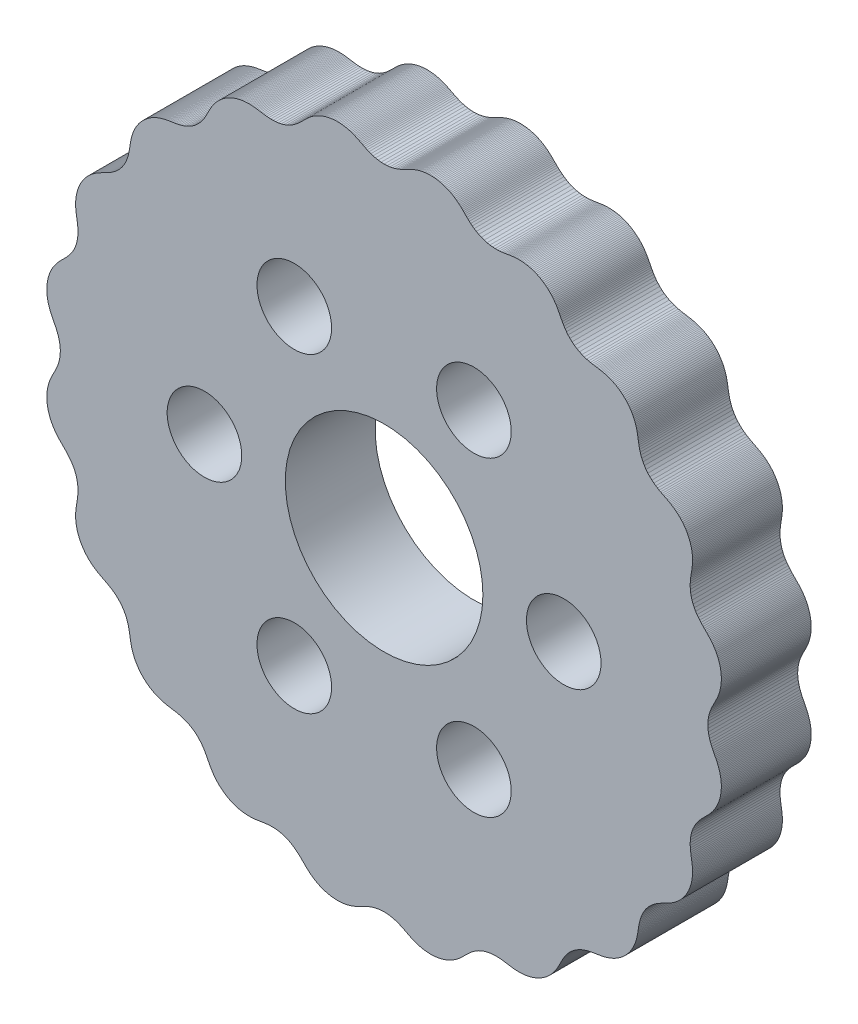
from build123d import *

# Parameters (mm, degrees)
MODEL_R             = 11
MODEL_R_2           = 4.15238095
BOSS_EXTRUDE1_DEPTH = 10


with BuildPart() as part:
    # Model → Boss-Extrude1 (new body)
    with BuildSketch(Plane.XY):
        Polygon((36.04761905, 0), (36.06137418, -0.33384437), (36.10068915, -0.65548231), (36.1604355, -0.9553158), (36.23400799, -1.22779715), (36.31504682, -1.47138623), (36.39850594, -1.68753694), (36.48096998, -1.87943994), (36.56047524, -2.05098989), (36.63613272, -2.2061181), (36.70774644, -2.34844079), (36.77550914, -2.4811182), (36.83978991, -2.60683211), (36.90099955, -2.72781973), (36.95951242, -2.84592824), (37.01562612, -2.96267195), (37.06954492, -3.07928401), (37.12137746, -3.1967604), (37.17114246, -3.31589586), (37.21877876, -3.43731283), (37.26415718, -3.56148478), (37.30709308, -3.68875492), (37.34735867, -3.81935152), (37.38469479, -3.95340063), (37.4188218, -4.09093693), (37.44944971, -4.23191308), (37.47628728, -4.37620823), (37.49905028, -4.52363572), (37.51746882, -4.6739504), (37.53129382, -4.82685556), (37.54030267, -4.98200972), (37.54430398, -5.13903327), (37.54314162, -5.29751505), (37.53669791, -5.45701883), (37.52489604, -5.61708986), (37.50770174, -5.77726126), (37.48512416, -5.93706041), (37.45721606, -6.09601529), (37.42407313, -6.25366067), (37.38583271, -6.40954425), (37.34267166, -6.56323258), (37.29480357, -6.71431689), (37.24247515, -6.86241869), (37.18596195, -7.00719518), (37.1255633, -7.14834446), (37.06159644, -7.28561058), (36.99438994, -7.41878831), (36.92427624, -7.54772788), (36.85158334, -7.67233962), (36.77662557, -7.79259858), (36.69969336, -7.90854938), (36.62104193, -8.02031137), (36.54087883, -8.12808454), (36.45935015, -8.23215638), (36.37652543, -8.33291036), (36.29238122, -8.43083668), (36.20678334, -8.52654623), (36.1194684, -8.62078907), (36.03002532, -8.71447884), (35.93787873, -8.80872525), (35.84227768, -8.90487649), (35.7422953, -9.00457367), (35.63684957, -9.10981756), (35.52476074, -9.22304462), (35.40486894, -9.34720087), (35.2762431, -9.48578609), (35.13851385, -9.6428139), (34.99234527, -9.82259516), (34.8399996, -10.02921976), (34.68582663, -10.26562977), (34.53635084, -10.53232573), (34.39956849, -10.82607259), (34.28332299, -11.13932689), (34.19324132, -11.46108233), (34.13124049, -11.77912718), (34.09540899, -12.08274841), (34.08117922, -12.36462872), (34.08297857, -12.62133808), (34.09555866, -12.85269991), (34.11468534, -13.0606933), (34.13728748, -13.24841547), (34.16130477, -13.41933061), (34.18543334, -13.57681739), (34.20887992, -13.72394093), (34.23116683, -13.86336581), (34.25199343, -13.9973467), (34.27114493, -14.12775604), (34.28843644, -14.25612599), (34.30368116, -14.38369248), (34.31667463, -14.5114363), (34.32718909, -14.64011909), (34.33497399, -14.77031392), (34.33976018, -14.90243116), (34.34126601, -15.03674018), (34.3392043, -15.17338767), (34.3332896, -15.31241345), (34.32324527, -15.45376407), (34.30881012, -15.5973049), (34.28974451, -15.742831), (34.26583581, -15.89007704), (34.23690309, -16.03872644), (34.20280116, -16.18842005), (34.16342381, -16.33876431), (34.11870633, -16.48933906), (34.06862731, -16.63970499), (34.01320959, -16.78941088), (33.95252068, -16.9380005), (33.88667224, -17.08501922), (33.81581904, -17.23002039), (33.74015709, -17.37257139), (33.65992119, -17.51225933), (33.57538171, -17.64869648), (33.48684081, -17.78152527), (33.39462793, -17.91042293), (33.29909468, -18.03510574), (33.20060904, -18.15533283), (33.09954897, -18.27090957), (32.99629531, -18.38169055), (32.89122395, -18.48758215), (32.78469734, -18.58854465), (32.67705514, -18.68459411), (32.568604, -18.77580396), (32.45960636, -18.86230635), (32.35026805, -18.9442937), (32.24072467, -19.02202031), (32.13102632, -19.09580476), (32.02112064, -19.16603325), (31.91083384, -19.23316472), (31.79984954, -19.29773872), (31.68768546, -19.36038718), (31.5736683, -19.42185202), (31.45690795, -19.48301082), (31.33627358, -19.54491373), (31.21037656, -19.60883513), (31.07756956, -19.67634349), (30.93597766, -19.74939148), (30.7835874, -19.83042248), (30.61843176, -19.92247729), (30.4389192, -20.02925893), (30.24434915, -20.1550725), (30.0356093, -20.30450677), (29.81592738, -20.48170398), (29.59135387, -20.68915635), (29.37049335, -20.92625815), (29.16313642, -21.18825886), (28.97803575, -21.46642969), (28.8207882, -21.74974901), (28.6928863, -22.02743742), (28.59224718, -22.29112429), (28.51463091, -22.53582542), (28.45510055, -22.75975106), (28.40901761, -22.96347499), (28.37250418, -23.14899384), (28.34253029, -23.31896555), (28.31681183, -23.47620051), (28.29364719, -23.62336871), (28.27175864, -23.76285668), (28.25016354, -23.89671585), (28.228079, -24.02666065), (28.20485571, -24.15409109), (28.17993408, -24.28012491), (28.1528166, -24.40563171), (28.12305127, -24.53126545), (28.09022273, -24.65749376), (28.0539482, -24.78462374), (28.01387657, -24.91282453), (27.96968936, -25.04214692), (27.92110282, -25.17254056), (27.86787035, -25.30386911), (27.80978515, -25.43592384), (27.74668264, -25.5684358), (27.67844258, -25.7010869), (27.60499074, -25.83352018), (27.52630001, -25.96534919), (27.44239099, -26.09616681), (27.35333199, -26.22555344), (27.25923838, -26.35308467), (27.16027133, -26.47833842), (27.05663603, -26.60090164), (26.94857916, -26.72037647), (26.83638593, -26.83638593), (26.72037647, -26.94857916), (26.60090164, -27.05663603), (26.47833842, -27.16027133), (26.35308467, -27.25923838), (26.22555344, -27.35333199), (26.09616681, -27.44239099), (25.96534919, -27.52630001), (25.83352018, -27.60499074), (25.7010869, -27.67844258), (25.5684358, -27.74668264), (25.43592384, -27.80978515), (25.30386911, -27.86787035), (25.17254056, -27.92110282), (25.04214692, -27.96968936), (24.91282453, -28.01387657), (24.78462374, -28.0539482), (24.65749376, -28.09022273), (24.53126545, -28.12305127), (24.40563171, -28.1528166), (24.28012491, -28.17993408), (24.15409109, -28.20485571), (24.02666065, -28.228079), (23.89671585, -28.25016354), (23.76285668, -28.27175864), (23.62336871, -28.29364719), (23.47620051, -28.31681183), (23.31896555, -28.34253029), (23.14899384, -28.37250418), (22.96347499, -28.40901761), (22.75975106, -28.45510055), (22.53582542, -28.51463091), (22.29112429, -28.59224718), (22.02743742, -28.6928863), (21.74974901, -28.8207882), (21.46642969, -28.97803575), (21.18825886, -29.16313642), (20.92625815, -29.37049335), (20.68915635, -29.59135387), (20.48170398, -29.81592738), (20.30450677, -30.0356093), (20.1550725, -30.24434915), (20.02925893, -30.4389192), (19.92247729, -30.61843176), (19.83042248, -30.7835874), (19.74939148, -30.93597766), (19.67634349, -31.07756956), (19.60883513, -31.21037656), (19.54491373, -31.33627358), (19.48301082, -31.45690795), (19.42185202, -31.5736683), (19.36038718, -31.68768546), (19.29773872, -31.79984954), (19.23316472, -31.91083384), (19.16603325, -32.02112064), (19.09580476, -32.13102632), (19.02202031, -32.24072467), (18.9442937, -32.35026805), (18.86230635, -32.45960636), (18.77580396, -32.568604), (18.68459411, -32.67705514), (18.58854465, -32.78469734), (18.48758215, -32.89122395), (18.38169055, -32.99629531), (18.27090957, -33.09954897), (18.15533283, -33.20060904), (18.03510574, -33.29909468), (17.91042293, -33.39462793), (17.78152527, -33.48684081), (17.64869648, -33.57538171), (17.51225933, -33.65992119), (17.37257139, -33.74015709), (17.23002039, -33.81581904), (17.08501922, -33.88667224), (16.9380005, -33.95252068), (16.78941088, -34.01320959), (16.63970499, -34.06862731), (16.48933906, -34.11870633), (16.33876431, -34.16342381), (16.18842005, -34.20280116), (16.03872644, -34.23690309), (15.89007704, -34.26583581), (15.742831, -34.28974451), (15.5973049, -34.30881012), (15.45376407, -34.32324527), (15.31241345, -34.3332896), (15.17338767, -34.3392043), (15.03674018, -34.34126601), (14.90243116, -34.33976018), (14.77031392, -34.33497399), (14.64011909, -34.32718909), (14.5114363, -34.31667463), (14.38369248, -34.30368116), (14.25612599, -34.28843644), (14.12775604, -34.27114493), (13.9973467, -34.25199343), (13.86336581, -34.23116683), (13.72394093, -34.20887992), (13.57681739, -34.18543334), (13.41933061, -34.16130477), (13.24841547, -34.13728748), (13.0606933, -34.11468534), (12.85269991, -34.09555866), (12.62133808, -34.08297857), (12.36462872, -34.08117922), (12.08274841, -34.09540899), (11.77912718, -34.13124049), (11.46108233, -34.19324132), (11.13932689, -34.28332299), (10.82607259, -34.39956849), (10.53232573, -34.53635084), (10.26562977, -34.68582663), (10.02921976, -34.8399996), (9.82259516, -34.99234527), (9.6428139, -35.13851385), (9.48578609, -35.2762431), (9.34720087, -35.40486894), (9.22304462, -35.52476074), (9.10981756, -35.63684957), (9.00457367, -35.7422953), (8.90487649, -35.84227768), (8.80872525, -35.93787873), (8.71447884, -36.03002532), (8.62078907, -36.1194684), (8.52654623, -36.20678334), (8.43083668, -36.29238122), (8.33291036, -36.37652543), (8.23215638, -36.45935015), (8.12808454, -36.54087883), (8.02031137, -36.62104193), (7.90854938, -36.69969336), (7.79259858, -36.77662557), (7.67233962, -36.85158334), (7.54772788, -36.92427624), (7.41878831, -36.99438994), (7.28561058, -37.06159644), (7.14834446, -37.1255633), (7.00719518, -37.18596195), (6.86241869, -37.24247515), (6.71431689, -37.29480357), (6.56323258, -37.34267166), (6.40954425, -37.38583271), (6.25366067, -37.42407313), (6.09601529, -37.45721606), (5.93706041, -37.48512416), (5.77726126, -37.50770174), (5.61708986, -37.52489604), (5.45701883, -37.53669791), (5.29751505, -37.54314162), (5.13903327, -37.54430398), (4.98200972, -37.54030267), (4.82685556, -37.53129382), (4.6739504, -37.51746882), (4.52363572, -37.49905028), (4.37620823, -37.47628728), (4.23191308, -37.44944971), (4.09093693, -37.4188218), (3.95340063, -37.38469479), (3.81935152, -37.34735867), (3.68875492, -37.30709308), (3.56148478, -37.26415718), (3.43731283, -37.21877876), (3.31589586, -37.17114246), (3.1967604, -37.12137746), (3.07928401, -37.06954492), (2.96267195, -37.01562612), (2.84592824, -36.95951242), (2.72781973, -36.90099955), (2.60683211, -36.83978991), (2.4811182, -36.77550914), (2.34844079, -36.70774644), (2.2061181, -36.63613272), (2.05098989, -36.56047524), (1.87943994, -36.48096998), (1.68753694, -36.39850594), (1.47138623, -36.31504682), (1.22779715, -36.23400799), (0.9553158, -36.1604355), (0.65548231, -36.10068915), (0.33384437, -36.06137418), (0, -36.04761905), (-0.33384437, -36.06137418), (-0.65548231, -36.10068915), (-0.9553158, -36.1604355), (-1.22779715, -36.23400799), (-1.47138623, -36.31504682), (-1.68753694, -36.39850594), (-1.87943994, -36.48096998), (-2.05098989, -36.56047524), (-2.2061181, -36.63613272), (-2.34844079, -36.70774644), (-2.4811182, -36.77550914), (-2.60683211, -36.83978991), (-2.72781973, -36.90099955), (-2.84592824, -36.95951242), (-2.96267195, -37.01562612), (-3.07928401, -37.06954492), (-3.1967604, -37.12137746), (-3.31589586, -37.17114246), (-3.43731283, -37.21877876), (-3.56148478, -37.26415718), (-3.68875492, -37.30709308), (-3.81935152, -37.34735867), (-3.95340063, -37.38469479), (-4.09093693, -37.4188218), (-4.23191308, -37.44944971), (-4.37620823, -37.47628728), (-4.52363572, -37.49905028), (-4.6739504, -37.51746882), (-4.82685556, -37.53129382), (-4.98200972, -37.54030267), (-5.13903327, -37.54430398), (-5.29751505, -37.54314162), (-5.45701883, -37.53669791), (-5.61708986, -37.52489604), (-5.77726126, -37.50770174), (-5.93706041, -37.48512416), (-6.09601529, -37.45721606), (-6.25366067, -37.42407313), (-6.40954425, -37.38583271), (-6.56323258, -37.34267166), (-6.71431689, -37.29480357), (-6.86241869, -37.24247515), (-7.00719518, -37.18596195), (-7.14834446, -37.1255633), (-7.28561058, -37.06159644), (-7.41878831, -36.99438994), (-7.54772788, -36.92427624), (-7.67233962, -36.85158334), (-7.79259858, -36.77662557), (-7.90854938, -36.69969336), (-8.02031137, -36.62104193), (-8.12808454, -36.54087883), (-8.23215638, -36.45935015), (-8.33291036, -36.37652543), (-8.43083668, -36.29238122), (-8.52654623, -36.20678334), (-8.62078907, -36.1194684), (-8.71447884, -36.03002532), (-8.80872525, -35.93787873), (-8.90487649, -35.84227768), (-9.00457367, -35.7422953), (-9.10981756, -35.63684957), (-9.22304462, -35.52476074), (-9.34720087, -35.40486894), (-9.48578609, -35.2762431), (-9.6428139, -35.13851385), (-9.82259516, -34.99234527), (-10.02921976, -34.8399996), (-10.26562977, -34.68582663), (-10.53232573, -34.53635084), (-10.82607259, -34.39956849), (-11.13932689, -34.28332299), (-11.46108233, -34.19324132), (-11.77912718, -34.13124049), (-12.08274841, -34.09540899), (-12.36462872, -34.08117922), (-12.62133808, -34.08297857), (-12.85269991, -34.09555866), (-13.0606933, -34.11468534), (-13.24841547, -34.13728748), (-13.41933061, -34.16130477), (-13.57681739, -34.18543334), (-13.72394093, -34.20887992), (-13.86336581, -34.23116683), (-13.9973467, -34.25199343), (-14.12775604, -34.27114493), (-14.25612599, -34.28843644), (-14.38369248, -34.30368116), (-14.5114363, -34.31667463), (-14.64011909, -34.32718909), (-14.77031392, -34.33497399), (-14.90243116, -34.33976018), (-15.03674018, -34.34126601), (-15.17338767, -34.3392043), (-15.31241345, -34.3332896), (-15.45376407, -34.32324527), (-15.5973049, -34.30881012), (-15.742831, -34.28974451), (-15.89007704, -34.26583581), (-16.03872644, -34.23690309), (-16.18842005, -34.20280116), (-16.33876431, -34.16342381), (-16.48933906, -34.11870633), (-16.63970499, -34.06862731), (-16.78941088, -34.01320959), (-16.9380005, -33.95252068), (-17.08501922, -33.88667224), (-17.23002039, -33.81581904), (-17.37257139, -33.74015709), (-17.51225933, -33.65992119), (-17.64869648, -33.57538171), (-17.78152527, -33.48684081), (-17.91042293, -33.39462793), (-18.03510574, -33.29909468), (-18.15533283, -33.20060904), (-18.27090957, -33.09954897), (-18.38169055, -32.99629531), (-18.48758215, -32.89122395), (-18.58854465, -32.78469734), (-18.68459411, -32.67705514), (-18.77580396, -32.568604), (-18.86230635, -32.45960636), (-18.9442937, -32.35026805), (-19.02202031, -32.24072467), (-19.09580476, -32.13102632), (-19.16603325, -32.02112064), (-19.23316472, -31.91083384), (-19.29773872, -31.79984954), (-19.36038718, -31.68768546), (-19.42185202, -31.5736683), (-19.48301082, -31.45690795), (-19.54491373, -31.33627358), (-19.60883513, -31.21037656), (-19.67634349, -31.07756956), (-19.74939148, -30.93597766), (-19.83042248, -30.7835874), (-19.92247729, -30.61843176), (-20.02925893, -30.4389192), (-20.1550725, -30.24434915), (-20.30450677, -30.0356093), (-20.48170398, -29.81592738), (-20.68915635, -29.59135387), (-20.92625815, -29.37049335), (-21.18825886, -29.16313642), (-21.46642969, -28.97803575), (-21.74974901, -28.8207882), (-22.02743742, -28.6928863), (-22.29112429, -28.59224718), (-22.53582542, -28.51463091), (-22.75975106, -28.45510055), (-22.96347499, -28.40901761), (-23.14899384, -28.37250418), (-23.31896555, -28.34253029), (-23.47620051, -28.31681183), (-23.62336871, -28.29364719), (-23.76285668, -28.27175864), (-23.89671585, -28.25016354), (-24.02666065, -28.228079), (-24.15409109, -28.20485571), (-24.28012491, -28.17993408), (-24.40563171, -28.1528166), (-24.53126545, -28.12305127), (-24.65749376, -28.09022273), (-24.78462374, -28.0539482), (-24.91282453, -28.01387657), (-25.04214692, -27.96968936), (-25.17254056, -27.92110282), (-25.30386911, -27.86787035), (-25.43592384, -27.80978515), (-25.5684358, -27.74668264), (-25.7010869, -27.67844258), (-25.83352018, -27.60499074), (-25.96534919, -27.52630001), (-26.09616681, -27.44239099), (-26.22555344, -27.35333199), (-26.35308467, -27.25923838), (-26.47833842, -27.16027133), (-26.60090164, -27.05663603), (-26.72037647, -26.94857916), (-26.83638593, -26.83638593), (-26.94857916, -26.72037647), (-27.05663603, -26.60090164), (-27.16027133, -26.47833842), (-27.25923838, -26.35308467), (-27.35333199, -26.22555344), (-27.44239099, -26.09616681), (-27.52630001, -25.96534919), (-27.60499074, -25.83352018), (-27.67844258, -25.7010869), (-27.74668264, -25.5684358), (-27.80978515, -25.43592384), (-27.86787035, -25.30386911), (-27.92110282, -25.17254056), (-27.96968936, -25.04214692), (-28.01387657, -24.91282453), (-28.0539482, -24.78462374), (-28.09022273, -24.65749376), (-28.12305127, -24.53126545), (-28.1528166, -24.40563171), (-28.17993408, -24.28012491), (-28.20485571, -24.15409109), (-28.228079, -24.02666065), (-28.25016354, -23.89671585), (-28.27175864, -23.76285668), (-28.29364719, -23.62336871), (-28.31681183, -23.47620051), (-28.34253029, -23.31896555), (-28.37250418, -23.14899384), (-28.40901761, -22.96347499), (-28.45510055, -22.75975106), (-28.51463091, -22.53582542), (-28.59224718, -22.29112429), (-28.6928863, -22.02743742), (-28.8207882, -21.74974901), (-28.97803575, -21.46642969), (-29.16313642, -21.18825886), (-29.37049335, -20.92625815), (-29.59135387, -20.68915635), (-29.81592738, -20.48170398), (-30.0356093, -20.30450677), (-30.24434915, -20.1550725), (-30.4389192, -20.02925893), (-30.61843176, -19.92247729), (-30.7835874, -19.83042248), (-30.93597766, -19.74939148), (-31.07756956, -19.67634349), (-31.21037656, -19.60883513), (-31.33627358, -19.54491373), (-31.45690795, -19.48301082), (-31.5736683, -19.42185202), (-31.68768546, -19.36038718), (-31.79984954, -19.29773872), (-31.91083384, -19.23316472), (-32.02112064, -19.16603325), (-32.13102632, -19.09580476), (-32.24072467, -19.02202031), (-32.35026805, -18.9442937), (-32.45960636, -18.86230635), (-32.568604, -18.77580396), (-32.67705514, -18.68459411), (-32.78469734, -18.58854465), (-32.89122395, -18.48758215), (-32.99629531, -18.38169055), (-33.09954897, -18.27090957), (-33.20060904, -18.15533283), (-33.29909468, -18.03510574), (-33.39462793, -17.91042293), (-33.48684081, -17.78152527), (-33.57538171, -17.64869648), (-33.65992119, -17.51225933), (-33.74015709, -17.37257139), (-33.81581904, -17.23002039), (-33.88667224, -17.08501922), (-33.95252068, -16.9380005), (-34.01320959, -16.78941088), (-34.06862731, -16.63970499), (-34.11870633, -16.48933906), (-34.16342381, -16.33876431), (-34.20280116, -16.18842005), (-34.23690309, -16.03872644), (-34.26583581, -15.89007704), (-34.28974451, -15.742831), (-34.30881012, -15.5973049), (-34.32324527, -15.45376407), (-34.3332896, -15.31241345), (-34.3392043, -15.17338767), (-34.34126601, -15.03674018), (-34.33976018, -14.90243116), (-34.33497399, -14.77031392), (-34.32718909, -14.64011909), (-34.31667463, -14.5114363), (-34.30368116, -14.38369248), (-34.28843644, -14.25612599), (-34.27114493, -14.12775604), (-34.25199343, -13.9973467), (-34.23116683, -13.86336581), (-34.20887992, -13.72394093), (-34.18543334, -13.57681739), (-34.16130477, -13.41933061), (-34.13728748, -13.24841547), (-34.11468534, -13.0606933), (-34.09555866, -12.85269991), (-34.08297857, -12.62133808), (-34.08117922, -12.36462872), (-34.09540899, -12.08274841), (-34.13124049, -11.77912718), (-34.19324132, -11.46108233), (-34.28332299, -11.13932689), (-34.39956849, -10.82607259), (-34.53635084, -10.53232573), (-34.68582663, -10.26562977), (-34.8399996, -10.02921976), (-34.99234527, -9.82259516), (-35.13851385, -9.6428139), (-35.2762431, -9.48578609), (-35.40486894, -9.34720087), (-35.52476074, -9.22304462), (-35.63684957, -9.10981756), (-35.7422953, -9.00457367), (-35.84227768, -8.90487649), (-35.93787873, -8.80872525), (-36.03002532, -8.71447884), (-36.1194684, -8.62078907), (-36.20678334, -8.52654623), (-36.29238122, -8.43083668), (-36.37652543, -8.33291036), (-36.45935015, -8.23215638), (-36.54087883, -8.12808454), (-36.62104193, -8.02031137), (-36.69969336, -7.90854938), (-36.77662557, -7.79259858), (-36.85158334, -7.67233962), (-36.92427624, -7.54772788), (-36.99438994, -7.41878831), (-37.06159644, -7.28561058), (-37.1255633, -7.14834446), (-37.18596195, -7.00719518), (-37.24247515, -6.86241869), (-37.29480357, -6.71431689), (-37.34267166, -6.56323258), (-37.38583271, -6.40954425), (-37.42407313, -6.25366067), (-37.45721606, -6.09601529), (-37.48512416, -5.93706041), (-37.50770174, -5.77726126), (-37.52489604, -5.61708986), (-37.53669791, -5.45701883), (-37.54314162, -5.29751505), (-37.54430398, -5.13903327), (-37.54030267, -4.98200972), (-37.53129382, -4.82685556), (-37.51746882, -4.6739504), (-37.49905028, -4.52363572), (-37.47628728, -4.37620823), (-37.44944971, -4.23191308), (-37.4188218, -4.09093693), (-37.38469479, -3.95340063), (-37.34735867, -3.81935152), (-37.30709308, -3.68875492), (-37.26415718, -3.56148478), (-37.21877876, -3.43731283), (-37.17114246, -3.31589586), (-37.12137746, -3.1967604), (-37.06954492, -3.07928401), (-37.01562612, -2.96267195), (-36.95951242, -2.84592824), (-36.90099955, -2.72781973), (-36.83978991, -2.60683211), (-36.77550914, -2.4811182), (-36.70774644, -2.34844079), (-36.63613272, -2.2061181), (-36.56047524, -2.05098989), (-36.48096998, -1.87943994), (-36.39850594, -1.68753694), (-36.31504682, -1.47138623), (-36.23400799, -1.22779715), (-36.1604355, -0.9553158), (-36.10068915, -0.65548231), (-36.06137418, -0.33384437), (-36.04761905, 0), (-36.06137418, 0.33384437), (-36.10068915, 0.65548231), (-36.1604355, 0.9553158), (-36.23400799, 1.22779715), (-36.31504682, 1.47138623), (-36.39850594, 1.68753694), (-36.48096998, 1.87943994), (-36.56047524, 2.05098989), (-36.63613272, 2.2061181), (-36.70774644, 2.34844079), (-36.77550914, 2.4811182), (-36.83978991, 2.60683211), (-36.90099955, 2.72781973), (-36.95951242, 2.84592824), (-37.01562612, 2.96267195), (-37.06954492, 3.07928401), (-37.12137746, 3.1967604), (-37.17114246, 3.31589586), (-37.21877876, 3.43731283), (-37.26415718, 3.56148478), (-37.30709308, 3.68875492), (-37.34735867, 3.81935152), (-37.38469479, 3.95340063), (-37.4188218, 4.09093693), (-37.44944971, 4.23191308), (-37.47628728, 4.37620823), (-37.49905028, 4.52363572), (-37.51746882, 4.6739504), (-37.53129382, 4.82685556), (-37.54030267, 4.98200972), (-37.54430398, 5.13903327), (-37.54314162, 5.29751505), (-37.53669791, 5.45701883), (-37.52489604, 5.61708986), (-37.50770174, 5.77726126), (-37.48512416, 5.93706041), (-37.45721606, 6.09601529), (-37.42407313, 6.25366067), (-37.38583271, 6.40954425), (-37.34267166, 6.56323258), (-37.29480357, 6.71431689), (-37.24247515, 6.86241869), (-37.18596195, 7.00719518), (-37.1255633, 7.14834446), (-37.06159644, 7.28561058), (-36.99438994, 7.41878831), (-36.92427624, 7.54772788), (-36.85158334, 7.67233962), (-36.77662557, 7.79259858), (-36.69969336, 7.90854938), (-36.62104193, 8.02031137), (-36.54087883, 8.12808454), (-36.45935015, 8.23215638), (-36.37652543, 8.33291036), (-36.29238122, 8.43083668), (-36.20678334, 8.52654623), (-36.1194684, 8.62078907), (-36.03002532, 8.71447884), (-35.93787873, 8.80872525), (-35.84227768, 8.90487649), (-35.7422953, 9.00457367), (-35.63684957, 9.10981756), (-35.52476074, 9.22304462), (-35.40486894, 9.34720087), (-35.2762431, 9.48578609), (-35.13851385, 9.6428139), (-34.99234527, 9.82259516), (-34.8399996, 10.02921976), (-34.68582663, 10.26562977), (-34.53635084, 10.53232573), (-34.39956849, 10.82607259), (-34.28332299, 11.13932689), (-34.19324132, 11.46108233), (-34.13124049, 11.77912718), (-34.09540899, 12.08274841), (-34.08117922, 12.36462872), (-34.08297857, 12.62133808), (-34.09555866, 12.85269991), (-34.11468534, 13.0606933), (-34.13728748, 13.24841547), (-34.16130477, 13.41933061), (-34.18543334, 13.57681739), (-34.20887992, 13.72394093), (-34.23116683, 13.86336581), (-34.25199343, 13.9973467), (-34.27114493, 14.12775604), (-34.28843644, 14.25612599), (-34.30368116, 14.38369248), (-34.31667463, 14.5114363), (-34.32718909, 14.64011909), (-34.33497399, 14.77031392), (-34.33976018, 14.90243116), (-34.34126601, 15.03674018), (-34.3392043, 15.17338767), (-34.3332896, 15.31241345), (-34.32324527, 15.45376407), (-34.30881012, 15.5973049), (-34.28974451, 15.742831), (-34.26583581, 15.89007704), (-34.23690309, 16.03872644), (-34.20280116, 16.18842005), (-34.16342381, 16.33876431), (-34.11870633, 16.48933906), (-34.06862731, 16.63970499), (-34.01320959, 16.78941088), (-33.95252068, 16.9380005), (-33.88667224, 17.08501922), (-33.81581904, 17.23002039), (-33.74015709, 17.37257139), (-33.65992119, 17.51225933), (-33.57538171, 17.64869648), (-33.48684081, 17.78152527), (-33.39462793, 17.91042293), (-33.29909468, 18.03510574), (-33.20060904, 18.15533283), (-33.09954897, 18.27090957), (-32.99629531, 18.38169055), (-32.89122395, 18.48758215), (-32.78469734, 18.58854465), (-32.67705514, 18.68459411), (-32.568604, 18.77580396), (-32.45960636, 18.86230635), (-32.35026805, 18.9442937), (-32.24072467, 19.02202031), (-32.13102632, 19.09580476), (-32.02112064, 19.16603325), (-31.91083384, 19.23316472), (-31.79984954, 19.29773872), (-31.68768546, 19.36038718), (-31.5736683, 19.42185202), (-31.45690795, 19.48301082), (-31.33627358, 19.54491373), (-31.21037656, 19.60883513), (-31.07756956, 19.67634349), (-30.93597766, 19.74939148), (-30.7835874, 19.83042248), (-30.61843176, 19.92247729), (-30.4389192, 20.02925893), (-30.24434915, 20.1550725), (-30.0356093, 20.30450677), (-29.81592738, 20.48170398), (-29.59135387, 20.68915635), (-29.37049335, 20.92625815), (-29.16313642, 21.18825886), (-28.97803575, 21.46642969), (-28.8207882, 21.74974901), (-28.6928863, 22.02743742), (-28.59224718, 22.29112429), (-28.51463091, 22.53582542), (-28.45510055, 22.75975106), (-28.40901761, 22.96347499), (-28.37250418, 23.14899384), (-28.34253029, 23.31896555), (-28.31681183, 23.47620051), (-28.29364719, 23.62336871), (-28.27175864, 23.76285668), (-28.25016354, 23.89671585), (-28.228079, 24.02666065), (-28.20485571, 24.15409109), (-28.17993408, 24.28012491), (-28.1528166, 24.40563171), (-28.12305127, 24.53126545), (-28.09022273, 24.65749376), (-28.0539482, 24.78462374), (-28.01387657, 24.91282453), (-27.96968936, 25.04214692), (-27.92110282, 25.17254056), (-27.86787035, 25.30386911), (-27.80978515, 25.43592384), (-27.74668264, 25.5684358), (-27.67844258, 25.7010869), (-27.60499074, 25.83352018), (-27.52630001, 25.96534919), (-27.44239099, 26.09616681), (-27.35333199, 26.22555344), (-27.25923838, 26.35308467), (-27.16027133, 26.47833842), (-27.05663603, 26.60090164), (-26.94857916, 26.72037647), (-26.83638593, 26.83638593), (-26.72037647, 26.94857916), (-26.60090164, 27.05663603), (-26.47833842, 27.16027133), (-26.35308467, 27.25923838), (-26.22555344, 27.35333199), (-26.09616681, 27.44239099), (-25.96534919, 27.52630001), (-25.83352018, 27.60499074), (-25.7010869, 27.67844258), (-25.5684358, 27.74668264), (-25.43592384, 27.80978515), (-25.30386911, 27.86787035), (-25.17254056, 27.92110282), (-25.04214692, 27.96968936), (-24.91282453, 28.01387657), (-24.78462374, 28.0539482), (-24.65749376, 28.09022273), (-24.53126545, 28.12305127), (-24.40563171, 28.1528166), (-24.28012491, 28.17993408), (-24.15409109, 28.20485571), (-24.02666065, 28.228079), (-23.89671585, 28.25016354), (-23.76285668, 28.27175864), (-23.62336871, 28.29364719), (-23.47620051, 28.31681183), (-23.31896555, 28.34253029), (-23.14899384, 28.37250418), (-22.96347499, 28.40901761), (-22.75975106, 28.45510055), (-22.53582542, 28.51463091), (-22.29112429, 28.59224718), (-22.02743742, 28.6928863), (-21.74974901, 28.8207882), (-21.46642969, 28.97803575), (-21.18825886, 29.16313642), (-20.92625815, 29.37049335), (-20.68915635, 29.59135387), (-20.48170398, 29.81592738), (-20.30450677, 30.0356093), (-20.1550725, 30.24434915), (-20.02925893, 30.4389192), (-19.92247729, 30.61843176), (-19.83042248, 30.7835874), (-19.74939148, 30.93597766), (-19.67634349, 31.07756956), (-19.60883513, 31.21037656), (-19.54491373, 31.33627358), (-19.48301082, 31.45690795), (-19.42185202, 31.5736683), (-19.36038718, 31.68768546), (-19.29773872, 31.79984954), (-19.23316472, 31.91083384), (-19.16603325, 32.02112064), (-19.09580476, 32.13102632), (-19.02202031, 32.24072467), (-18.9442937, 32.35026805), (-18.86230635, 32.45960636), (-18.77580396, 32.568604), (-18.68459411, 32.67705514), (-18.58854465, 32.78469734), (-18.48758215, 32.89122395), (-18.38169055, 32.99629531), (-18.27090957, 33.09954897), (-18.15533283, 33.20060904), (-18.03510574, 33.29909468), (-17.91042293, 33.39462793), (-17.78152527, 33.48684081), (-17.64869648, 33.57538171), (-17.51225933, 33.65992119), (-17.37257139, 33.74015709), (-17.23002039, 33.81581904), (-17.08501922, 33.88667224), (-16.9380005, 33.95252068), (-16.78941088, 34.01320959), (-16.63970499, 34.06862731), (-16.48933906, 34.11870633), (-16.33876431, 34.16342381), (-16.18842005, 34.20280116), (-16.03872644, 34.23690309), (-15.89007704, 34.26583581), (-15.742831, 34.28974451), (-15.5973049, 34.30881012), (-15.45376407, 34.32324527), (-15.31241345, 34.3332896), (-15.17338767, 34.3392043), (-15.03674018, 34.34126601), (-14.90243116, 34.33976018), (-14.77031392, 34.33497399), (-14.64011909, 34.32718909), (-14.5114363, 34.31667463), (-14.38369248, 34.30368116), (-14.25612599, 34.28843644), (-14.12775604, 34.27114493), (-13.9973467, 34.25199343), (-13.86336581, 34.23116683), (-13.72394093, 34.20887992), (-13.57681739, 34.18543334), (-13.41933061, 34.16130477), (-13.24841547, 34.13728748), (-13.0606933, 34.11468534), (-12.85269991, 34.09555866), (-12.62133808, 34.08297857), (-12.36462872, 34.08117922), (-12.08274841, 34.09540899), (-11.77912718, 34.13124049), (-11.46108233, 34.19324132), (-11.13932689, 34.28332299), (-10.82607259, 34.39956849), (-10.53232573, 34.53635084), (-10.26562977, 34.68582663), (-10.02921976, 34.8399996), (-9.82259516, 34.99234527), (-9.6428139, 35.13851385), (-9.48578609, 35.2762431), (-9.34720087, 35.40486894), (-9.22304462, 35.52476074), (-9.10981756, 35.63684957), (-9.00457367, 35.7422953), (-8.90487649, 35.84227768), (-8.80872525, 35.93787873), (-8.71447884, 36.03002532), (-8.62078907, 36.1194684), (-8.52654623, 36.20678334), (-8.43083668, 36.29238122), (-8.33291036, 36.37652543), (-8.23215638, 36.45935015), (-8.12808454, 36.54087883), (-8.02031137, 36.62104193), (-7.90854938, 36.69969336), (-7.79259858, 36.77662557), (-7.67233962, 36.85158334), (-7.54772788, 36.92427624), (-7.41878831, 36.99438994), (-7.28561058, 37.06159644), (-7.14834446, 37.1255633), (-7.00719518, 37.18596195), (-6.86241869, 37.24247515), (-6.71431689, 37.29480357), (-6.56323258, 37.34267166), (-6.40954425, 37.38583271), (-6.25366067, 37.42407313), (-6.09601529, 37.45721606), (-5.93706041, 37.48512416), (-5.77726126, 37.50770174), (-5.61708986, 37.52489604), (-5.45701883, 37.53669791), (-5.29751505, 37.54314162), (-5.13903327, 37.54430398), (-4.98200972, 37.54030267), (-4.82685556, 37.53129382), (-4.6739504, 37.51746882), (-4.52363572, 37.49905028), (-4.37620823, 37.47628728), (-4.23191308, 37.44944971), (-4.09093693, 37.4188218), (-3.95340063, 37.38469479), (-3.81935152, 37.34735867), (-3.68875492, 37.30709308), (-3.56148478, 37.26415718), (-3.43731283, 37.21877876), (-3.31589586, 37.17114246), (-3.1967604, 37.12137746), (-3.07928401, 37.06954492), (-2.96267195, 37.01562612), (-2.84592824, 36.95951242), (-2.72781973, 36.90099955), (-2.60683211, 36.83978991), (-2.4811182, 36.77550914), (-2.34844079, 36.70774644), (-2.2061181, 36.63613272), (-2.05098989, 36.56047524), (-1.87943994, 36.48096998), (-1.68753694, 36.39850594), (-1.47138623, 36.31504682), (-1.22779715, 36.23400799), (-0.9553158, 36.1604355), (-0.65548231, 36.10068915), (-0.33384437, 36.06137418), (0, 36.04761905), (0.33384437, 36.06137418), (0.65548231, 36.10068915), (0.9553158, 36.1604355), (1.22779715, 36.23400799), (1.47138623, 36.31504682), (1.68753694, 36.39850594), (1.87943994, 36.48096998), (2.05098989, 36.56047524), (2.2061181, 36.63613272), (2.34844079, 36.70774644), (2.4811182, 36.77550914), (2.60683211, 36.83978991), (2.72781973, 36.90099955), (2.84592824, 36.95951242), (2.96267195, 37.01562612), (3.07928401, 37.06954492), (3.1967604, 37.12137746), (3.31589586, 37.17114246), (3.43731283, 37.21877876), (3.56148478, 37.26415718), (3.68875492, 37.30709308), (3.81935152, 37.34735867), (3.95340063, 37.38469479), (4.09093693, 37.4188218), (4.23191308, 37.44944971), (4.37620823, 37.47628728), (4.52363572, 37.49905028), (4.6739504, 37.51746882), (4.82685556, 37.53129382), (4.98200972, 37.54030267), (5.13903327, 37.54430398), (5.29751505, 37.54314162), (5.45701883, 37.53669791), (5.61708986, 37.52489604), (5.77726126, 37.50770174), (5.93706041, 37.48512416), (6.09601529, 37.45721606), (6.25366067, 37.42407313), (6.40954425, 37.38583271), (6.56323258, 37.34267166), (6.71431689, 37.29480357), (6.86241869, 37.24247515), (7.00719518, 37.18596195), (7.14834446, 37.1255633), (7.28561058, 37.06159644), (7.41878831, 36.99438994), (7.54772788, 36.92427624), (7.67233962, 36.85158334), (7.79259858, 36.77662557), (7.90854938, 36.69969336), (8.02031137, 36.62104193), (8.12808454, 36.54087883), (8.23215638, 36.45935015), (8.33291036, 36.37652543), (8.43083668, 36.29238122), (8.52654623, 36.20678334), (8.62078907, 36.1194684), (8.71447884, 36.03002532), (8.80872525, 35.93787873), (8.90487649, 35.84227768), (9.00457367, 35.7422953), (9.10981756, 35.63684957), (9.22304462, 35.52476074), (9.34720087, 35.40486894), (9.48578609, 35.2762431), (9.6428139, 35.13851385), (9.82259516, 34.99234527), (10.02921976, 34.8399996), (10.26562977, 34.68582663), (10.53232573, 34.53635084), (10.82607259, 34.39956849), (11.13932689, 34.28332299), (11.46108233, 34.19324132), (11.77912718, 34.13124049), (12.08274841, 34.09540899), (12.36462872, 34.08117922), (12.62133808, 34.08297857), (12.85269991, 34.09555866), (13.0606933, 34.11468534), (13.24841547, 34.13728748), (13.41933061, 34.16130477), (13.57681739, 34.18543334), (13.72394093, 34.20887992), (13.86336581, 34.23116683), (13.9973467, 34.25199343), (14.12775604, 34.27114493), (14.25612599, 34.28843644), (14.38369248, 34.30368116), (14.5114363, 34.31667463), (14.64011909, 34.32718909), (14.77031392, 34.33497399), (14.90243116, 34.33976018), (15.03674018, 34.34126601), (15.17338767, 34.3392043), (15.31241345, 34.3332896), (15.45376407, 34.32324527), (15.5973049, 34.30881012), (15.742831, 34.28974451), (15.89007704, 34.26583581), (16.03872644, 34.23690309), (16.18842005, 34.20280116), (16.33876431, 34.16342381), (16.48933906, 34.11870633), (16.63970499, 34.06862731), (16.78941088, 34.01320959), (16.9380005, 33.95252068), (17.08501922, 33.88667224), (17.23002039, 33.81581904), (17.37257139, 33.74015709), (17.51225933, 33.65992119), (17.64869648, 33.57538171), (17.78152527, 33.48684081), (17.91042293, 33.39462793), (18.03510574, 33.29909468), (18.15533283, 33.20060904), (18.27090957, 33.09954897), (18.38169055, 32.99629531), (18.48758215, 32.89122395), (18.58854465, 32.78469734), (18.68459411, 32.67705514), (18.77580396, 32.568604), (18.86230635, 32.45960636), (18.9442937, 32.35026805), (19.02202031, 32.24072467), (19.09580476, 32.13102632), (19.16603325, 32.02112064), (19.23316472, 31.91083384), (19.29773872, 31.79984954), (19.36038718, 31.68768546), (19.42185202, 31.5736683), (19.48301082, 31.45690795), (19.54491373, 31.33627358), (19.60883513, 31.21037656), (19.67634349, 31.07756956), (19.74939148, 30.93597766), (19.83042248, 30.7835874), (19.92247729, 30.61843176), (20.02925893, 30.4389192), (20.1550725, 30.24434915), (20.30450677, 30.0356093), (20.48170398, 29.81592738), (20.68915635, 29.59135387), (20.92625815, 29.37049335), (21.18825886, 29.16313642), (21.46642969, 28.97803575), (21.74974901, 28.8207882), (22.02743742, 28.6928863), (22.29112429, 28.59224718), (22.53582542, 28.51463091), (22.75975106, 28.45510055), (22.96347499, 28.40901761), (23.14899384, 28.37250418), (23.31896555, 28.34253029), (23.47620051, 28.31681183), (23.62336871, 28.29364719), (23.76285668, 28.27175864), (23.89671585, 28.25016354), (24.02666065, 28.228079), (24.15409109, 28.20485571), (24.28012491, 28.17993408), (24.40563171, 28.1528166), (24.53126545, 28.12305127), (24.65749376, 28.09022273), (24.78462374, 28.0539482), (24.91282453, 28.01387657), (25.04214692, 27.96968936), (25.17254056, 27.92110282), (25.30386911, 27.86787035), (25.43592384, 27.80978515), (25.5684358, 27.74668264), (25.7010869, 27.67844258), (25.83352018, 27.60499074), (25.96534919, 27.52630001), (26.09616681, 27.44239099), (26.22555344, 27.35333199), (26.35308467, 27.25923838), (26.47833842, 27.16027133), (26.60090164, 27.05663603), (26.72037647, 26.94857916), (26.83638593, 26.83638593), (26.94857916, 26.72037647), (27.05663603, 26.60090164), (27.16027133, 26.47833842), (27.25923838, 26.35308467), (27.35333199, 26.22555344), (27.44239099, 26.09616681), (27.52630001, 25.96534919), (27.60499074, 25.83352018), (27.67844258, 25.7010869), (27.74668264, 25.5684358), (27.80978515, 25.43592384), (27.86787035, 25.30386911), (27.92110282, 25.17254056), (27.96968936, 25.04214692), (28.01387657, 24.91282453), (28.0539482, 24.78462374), (28.09022273, 24.65749376), (28.12305127, 24.53126545), (28.1528166, 24.40563171), (28.17993408, 24.28012491), (28.20485571, 24.15409109), (28.228079, 24.02666065), (28.25016354, 23.89671585), (28.27175864, 23.76285668), (28.29364719, 23.62336871), (28.31681183, 23.47620051), (28.34253029, 23.31896555), (28.37250418, 23.14899384), (28.40901761, 22.96347499), (28.45510055, 22.75975106), (28.51463091, 22.53582542), (28.59224718, 22.29112429), (28.6928863, 22.02743742), (28.8207882, 21.74974901), (28.97803575, 21.46642969), (29.16313642, 21.18825886), (29.37049335, 20.92625815), (29.59135387, 20.68915635), (29.81592738, 20.48170398), (30.0356093, 20.30450677), (30.24434915, 20.1550725), (30.4389192, 20.02925893), (30.61843176, 19.92247729), (30.7835874, 19.83042248), (30.93597766, 19.74939148), (31.07756956, 19.67634349), (31.21037656, 19.60883513), (31.33627358, 19.54491373), (31.45690795, 19.48301082), (31.5736683, 19.42185202), (31.68768546, 19.36038718), (31.79984954, 19.29773872), (31.91083384, 19.23316472), (32.02112064, 19.16603325), (32.13102632, 19.09580476), (32.24072467, 19.02202031), (32.35026805, 18.9442937), (32.45960636, 18.86230635), (32.568604, 18.77580396), (32.67705514, 18.68459411), (32.78469734, 18.58854465), (32.89122395, 18.48758215), (32.99629531, 18.38169055), (33.09954897, 18.27090957), (33.20060904, 18.15533283), (33.29909468, 18.03510574), (33.39462793, 17.91042293), (33.48684081, 17.78152527), (33.57538171, 17.64869648), (33.65992119, 17.51225933), (33.74015709, 17.37257139), (33.81581904, 17.23002039), (33.88667224, 17.08501922), (33.95252068, 16.9380005), (34.01320959, 16.78941088), (34.06862731, 16.63970499), (34.11870633, 16.48933906), (34.16342381, 16.33876431), (34.20280116, 16.18842005), (34.23690309, 16.03872644), (34.26583581, 15.89007704), (34.28974451, 15.742831), (34.30881012, 15.5973049), (34.32324527, 15.45376407), (34.3332896, 15.31241345), (34.3392043, 15.17338767), (34.34126601, 15.03674018), (34.33976018, 14.90243116), (34.33497399, 14.77031392), (34.32718909, 14.64011909), (34.31667463, 14.5114363), (34.30368116, 14.38369248), (34.28843644, 14.25612599), (34.27114493, 14.12775604), (34.25199343, 13.9973467), (34.23116683, 13.86336581), (34.20887992, 13.72394093), (34.18543334, 13.57681739), (34.16130477, 13.41933061), (34.13728748, 13.24841547), (34.11468534, 13.0606933), (34.09555866, 12.85269991), (34.08297857, 12.62133808), (34.08117922, 12.36462872), (34.09540899, 12.08274841), (34.13124049, 11.77912718), (34.19324132, 11.46108233), (34.28332299, 11.13932689), (34.39956849, 10.82607259), (34.53635084, 10.53232573), (34.68582663, 10.26562977), (34.8399996, 10.02921976), (34.99234527, 9.82259516), (35.13851385, 9.6428139), (35.2762431, 9.48578609), (35.40486894, 9.34720087), (35.52476074, 9.22304462), (35.63684957, 9.10981756), (35.7422953, 9.00457367), (35.84227768, 8.90487649), (35.93787873, 8.80872525), (36.03002532, 8.71447884), (36.1194684, 8.62078907), (36.20678334, 8.52654623), (36.29238122, 8.43083668), (36.37652543, 8.33291036), (36.45935015, 8.23215638), (36.54087883, 8.12808454), (36.62104193, 8.02031137), (36.69969336, 7.90854938), (36.77662557, 7.79259858), (36.85158334, 7.67233962), (36.92427624, 7.54772788), (36.99438994, 7.41878831), (37.06159644, 7.28561058), (37.1255633, 7.14834446), (37.18596195, 7.00719518), (37.24247515, 6.86241869), (37.29480357, 6.71431689), (37.34267166, 6.56323258), (37.38583271, 6.40954425), (37.42407313, 6.25366067), (37.45721606, 6.09601529), (37.48512416, 5.93706041), (37.50770174, 5.77726126), (37.52489604, 5.61708986), (37.53669791, 5.45701883), (37.54314162, 5.29751505), (37.54430398, 5.13903327), (37.54030267, 4.98200972), (37.53129382, 4.82685556), (37.51746882, 4.6739504), (37.49905028, 4.52363572), (37.47628728, 4.37620823), (37.44944971, 4.23191308), (37.4188218, 4.09093693), (37.38469479, 3.95340063), (37.34735867, 3.81935152), (37.30709308, 3.68875492), (37.26415718, 3.56148478), (37.21877876, 3.43731283), (37.17114246, 3.31589586), (37.12137746, 3.1967604), (37.06954492, 3.07928401), (37.01562612, 2.96267195), (36.95951242, 2.84592824), (36.90099955, 2.72781973), (36.83978991, 2.60683211), (36.77550914, 2.4811182), (36.70774644, 2.34844079), (36.63613272, 2.2061181), (36.56047524, 2.05098989), (36.48096998, 1.87943994), (36.39850594, 1.68753694), (36.31504682, 1.47138623), (36.23400799, 1.22779715), (36.1604355, 0.9553158), (36.10068915, 0.65548231), (36.06137418, 0.33384437), align=None)
        Circle(MODEL_R, mode=Mode.SUBTRACT)
        with Locations((20, 0)):
            Circle(MODEL_R_2, mode=Mode.SUBTRACT)
        with Locations((10, 17.32050808)):
            Circle(MODEL_R_2, mode=Mode.SUBTRACT)
        with Locations((-10, 17.32050808)):
            Circle(MODEL_R_2, mode=Mode.SUBTRACT)
        with Locations((-20, 0)):
            Circle(MODEL_R_2, mode=Mode.SUBTRACT)
        with Locations((-10, -17.32050808)):
            Circle(MODEL_R_2, mode=Mode.SUBTRACT)
        with Locations((10, -17.32050808)):
            Circle(MODEL_R_2, mode=Mode.SUBTRACT)
    extrude(amount=BOSS_EXTRUDE1_DEPTH)


solid = part.part
